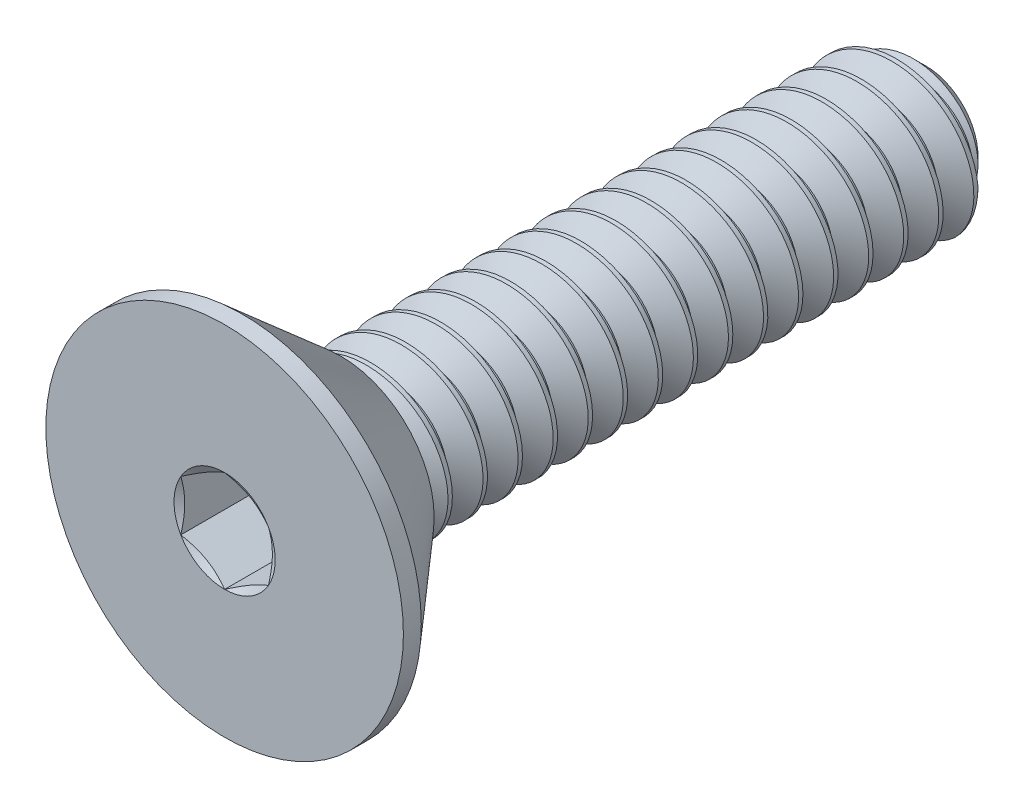
from build123d import *

# Parameters (mm, degrees)
SKETCH1_W          = 12.7
SKETCH1_H          = 1.4224
CHAMFER1_SIZE      = 0.47625
CUT_SWEEP1_PITCH   = 0.635
CUT_EXTRUDE2_DEPTH = 1.47574


with BuildPart() as part:
    # Sketch1 → Revolve1 (revolve)
    with BuildSketch(Plane(origin=(0, 0, 0), x_dir=(0, 0, -1), z_dir=(1, 0, 0))):
        with Locations((6.35, 0.7112)):
            Rectangle(SKETCH1_W, SKETCH1_H)
    revolve(axis=Axis((0, 0, -12.7), (0, 0, 1)))

    # Chamfer1
    chamfer1_edges = [part.edges().sort_by_distance(p)[0] for p in [
        (0, -1.4224, -12.7),
    ]]
    chamfer(chamfer1_edges, length=CHAMFER1_SIZE)

    # Cut-Sweep1: the profile of Sketch2 profile screwed along a right-hand helix of 20 turns, 6 arcs to a turn; built about Z, then put on its axis
    cut_sweep1_z = Axis((0, 0, 0), (0, 0, 1))
    cut_sweep1_corners = [(1.4227, 0, 0.000173205), (1.4227, 0, -0.555798205), (1.009955401, 0, -0.3175), (1.009955401, 0, -0.238125)]
    with BuildLine(mode=Mode.PRIVATE) as cut_sweep1_profile:
        Line(cut_sweep1_corners[0], cut_sweep1_corners[1])
        Line(cut_sweep1_corners[1], cut_sweep1_corners[2])
        Line(cut_sweep1_corners[2], cut_sweep1_corners[3])
        Line(cut_sweep1_corners[3], cut_sweep1_corners[0])
    cut_sweep1_cap = Face(cut_sweep1_profile.wire())
    cut_sweep1_turn_angles = [0, 30, 60, 90, 120, 150, 180, 210, 240, 270, 300, 330, 360]
    cut_sweep1_turn_weights = [1, 0.8660254037844387, 1, 0.8660254037844387, 1, 0.8660254037844387, 1, 0.8660254037844387, 1, 0.8660254037844387, 1, 0.8660254037844387, 1]
    cut_sweep1_turn_rails = [Edge.make_bspline([Vector(p[0], p[1], 0).rotate(cut_sweep1_z, cut_sweep1_turn_angles[k]) / cut_sweep1_turn_weights[k] + Vector(0, 0, p[2] + CUT_SWEEP1_PITCH * cut_sweep1_turn_angles[k] / 360) for k in range(13)], [0, 0, 0, 1, 1, 2, 2, 3, 3, 4, 4, 5, 5, 6, 6, 6], 2, cut_sweep1_turn_weights) for p in cut_sweep1_corners]
    cut_sweep1_turn_sides = [Face.make_surface_from_curves(cut_sweep1_turn_rails[p[0]], cut_sweep1_turn_rails[p[1]]) for p in [(0, 1), (1, 2), (2, 3), (3, 0)]]
    cut_sweep1 = Plane(origin=(0, 0, -12.7), x_dir=(0, 1, 0), z_dir=(0, 0, 1)) * Solid(Shell([*[p.moved(Location((0, 0, CUT_SWEEP1_PITCH * i))) for i in range(20) for p in cut_sweep1_turn_sides], cut_sweep1_cap, cut_sweep1_cap.rotate(cut_sweep1_z, 7200).moved(Location((0, 0, CUT_SWEEP1_PITCH * 7200 / 360)))]))
    add(cut_sweep1, mode=Mode.SUBTRACT)

    # Sketch7 → Revolve2 (revolve)
    with BuildSketch(Plane(origin=(0, 0, 0), x_dir=(0, 0, -1), z_dir=(1, 0, 0)), mode=Mode.PRIVATE) as revolve2_sk:
        Polygon((0, 3.2385), (0.32385, 3.2385), (2.1082, 1.687388209), (2.1082, 0), (0, 0), align=None)
    revolve(revolve2_sk.sketch.rotate(Axis((0, 0, 0), (0, 0, -1)), 189.336081704), axis=Axis((0, 0, 0), (0, 0, -1)))

    # Boss-Extrude1 cone 1 section (through the dimple's axis) → Boss-Extrude1 (revolve)
    with BuildSketch(Plane(origin=(0, 0, -2.1082), x_dir=(0, -1, 0), z_dir=(1, 0, 0))):
        Polygon((0, 0), (1.4224, 0), (0, 1.373595713), align=None)
    revolve(axis=Axis((0, 0, -2.1082), (0, 0, -1)))

    # Sketch5 → Cut-Extrude2 (cut)
    with BuildSketch(Plane.XY):
        Polygon((0, 0.916543552), (-0.79375, 0.458271776), (-0.79375, -0.458271776), (0, -0.916543552), (0.79375, -0.458271776), (0.79375, 0.458271776), align=None)
    extrude(amount=-CUT_EXTRUDE2_DEPTH, mode=Mode.SUBTRACT)

    # Cut-Extrude3 cone 1 section (through the dimple's axis) → Cut-Extrude3 (revolve, cut)
    with BuildSketch(Plane(origin=(0, 0, 0), x_dir=(0, -1, 0), z_dir=(1, 0, 0))):
        Polygon((0, 0), (0.916543552, 0), (0, 0.529166667), align=None)
    revolve(axis=Axis((0, 0, 0), (0, 0, -1)), mode=Mode.SUBTRACT)


solid = part.part
